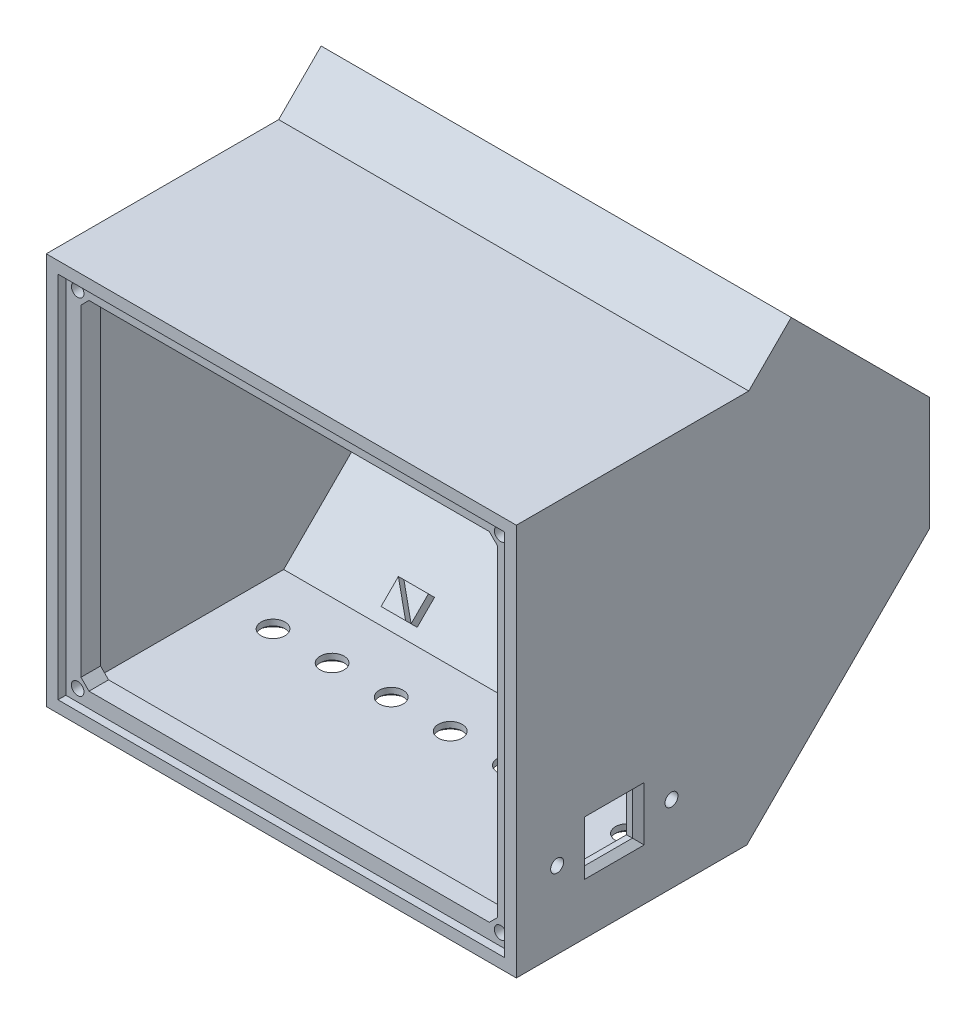
from build123d import *

# Parameters (mm, degrees)
BASEEXTRUDE_DEPTH        = 60
BASEEXTRUDE_DEPTH_BACK   = 60
SHELL2_T                 = -3
CONTROL_PANEL_W          = 110
CONTROL_PANEL_H          = 40
CUT_EXTRUDE1_DEPTH       = 10
CUT_EXTRUDE2_START       = 57
CUT_EXTRUDE2_OUTLINE_W   = 10.8
CUT_EXTRUDE2_OUTLINE_H   = 12.25
CUT_EXTRUDE2_OUTLINE_R   = 1.65
CUT_EXTRUDE2_DEPTH       = 3
REAR_PORTS_R             = 3.05
CUT_EXTRUDE3_DEPTH       = 3
REAR_PORTS_3_R           = 3.875
REAR_PORTS_3_R_2         = 3.05
CUT_EXTRUDE4_DEPTH       = 1.5
FILLET1_R                = 1.5
BOSS_EXTRUDE2_START      = 122.068760184
BOSS_EXTRUDE2_DEPTH      = 5
BOSS_EXTRUDE3_START      = 122.068760184
BOSS_EXTRUDE3_DEPTH      = 5
FILLET3_R                = 1.5
CUT_EXTRUDE6_START       = 122.068760184
CUT_EXTRUDE6_OUTLINE_R   = 1
CUT_EXTRUDE6_DEPTH       = 5
FILLET3_OF_MIRROR2_R     = 1.5
SKETCH17_W               = 90
SKETCH17_H               = 2
BOSS_EXTRUDE4_DEPTH      = 3.5
BOSS_EXTRUDE5_DEPTH      = 3.5
SKETCH19_W               = 90
SKETCH19_H               = 2
BOSS_EXTRUDE6_DEPTH      = 3.5
CONVERTOR_IN_PLACE_R     = 3.175
BOSS_EXTRUDE8_DEPTH      = 7.2
BOSS_EXTRUDE9_DEPTH      = 7.2
CONVERTOR_IN_PLACE_5_R   = 4.501396483
CONVERTOR_IN_PLACE_5_R_2 = 3.175
BOSS_EXTRUDE11_DEPTH     = 5.2
CUT_EXTRUDE7_START       = -2
CONVERTOR_IN_PLACE_7_R   = 1.7
CUT_EXTRUDE7_DEPTH       = 5.2
CHAMFER1_SIZE            = 1.5
BOSS_EXTRUDE12_START     = -2
BASE_W                   = 102.182919438
BASE_H                   = 6.863303695
BASE_W_2                 = 6.863303695
BASE_H_2                 = 82.284864873
BASE_R                   = 1.6
BOSS_EXTRUDE12_DEPTH     = 5


# Read off the part's stored shape, not the designer's step: Cut-Extrude2, Boss-Extrude2, Boss-Extrude3, Cut-Extrude6
with BuildPart() as part:
    # Silhouoette → BaseExtrude (new, two sides: drawn at the far end of the back side and taken through both)
    with BuildSketch(Plane(origin=(0, 0, 0), x_dir=(0, 0, -1), z_dir=(1, 0, 0)).offset(-BASEEXTRUDE_DEPTH_BACK)):
        Polygon((59.318338504, 100.101945435), (0, 100.101945435), (0, 0), (58.852776819, 0), (105.521824378, 46.669047558), (105.521824378, 75.59475319), (70.166485318, 110.950092249), align=None)
    extrude(amount=BASEEXTRUDE_DEPTH + BASEEXTRUDE_DEPTH_BACK)

    # Shell2
    shell2_openings = [part.faces().sort_by_distance(p)[0] for p in [
        (0, 50.050972717, 0),
    ]]
    offset(amount=SHELL2_T, openings=shell2_openings, kind=Kind.INTERSECTION)

    # Control Panel → Cut-Extrude1 (cut)
    with BuildSketch(Plane(origin=(0, 90.558288784, -90.558288784), x_dir=(-1, 0, 0), z_dir=(0, -0.7071067811865477, 0.7071067811865474))):
        with Locations((0, -3.838365022)):
            Rectangle(CONTROL_PANEL_W, CONTROL_PANEL_H)
    extrude(amount=CUT_EXTRUDE1_DEPTH, mode=Mode.SUBTRACT)

    # Cut-Extrude2 outline → Cut-Extrude2 (cut)
    with BuildSketch(Plane.YZ.offset(CUT_EXTRUDE2_START)):
        with Locations((20, -25)):
            Rectangle(CUT_EXTRUDE2_OUTLINE_W, CUT_EXTRUDE2_OUTLINE_H)
        with Locations((19.651957534, -39.6)):
            Circle(CUT_EXTRUDE2_OUTLINE_R)
        with Locations((19.651957534, -10.4)):
            Circle(CUT_EXTRUDE2_OUTLINE_R)
    extrude(amount=CUT_EXTRUDE2_DEPTH, mode=Mode.SUBTRACT)

    # Rear Ports → Cut-Extrude3 (cut)
    with BuildSketch(Plane(origin=(0, 0, 0), x_dir=(1, 0, 0), z_dir=(0, 1, 0))):
        with Locations(Location((45.232527778, 43.12294032, 0), (0, 0, 90))):
            Circle(REAR_PORTS_R)
        with Locations(Location((30.155018519, 43.12294032, 0), (0, 0, 90))):
            Circle(REAR_PORTS_R)
        with Locations(Location((15.077509259, 43.12294032, 0), (0, 0, 90))):
            Circle(REAR_PORTS_R)
        with Locations(Location((-15.077509259, 43.12294032, 0), (0, 0, 90))):
            Circle(REAR_PORTS_R)
        with Locations(Location((-30.155018519, 43.12294032, 0), (0, 0, 90))):
            Circle(REAR_PORTS_R)
        with Locations(Location((-45.232527778, 43.12294032, 0), (0, 0, 90))):
            Circle(REAR_PORTS_R)
        with Locations(Location((0, 43.12294032, 0), (0, 0, 90))):
            Circle(REAR_PORTS_R)
    extrude(amount=CUT_EXTRUDE3_DEPTH, mode=Mode.SUBTRACT)

    # Rear Ports<3> → Cut-Extrude4 (cut)
    # profile 1 of 7: a face of its own
    with BuildSketch(Plane(origin=(0, 0, 0), x_dir=(1, 0, 0), z_dir=(0, 1, 0))):
        with Locations(Location((45.232527778, 43.12294032, 0), (0, 0, 90))):
            Circle(REAR_PORTS_3_R)
        with Locations(Location((45.232527778, 43.12294032, 0), (0, 0, 90))):
            Circle(REAR_PORTS_3_R_2, mode=Mode.SUBTRACT)
    # profile 2 of 7: a face of its own
    with BuildSketch(Plane(origin=(0, 0, 0), x_dir=(1, 0, 0), z_dir=(0, 1, 0))):
        with Locations(Location((30.155018519, 43.12294032, 0), (0, 0, 90))):
            Circle(REAR_PORTS_3_R)
        with Locations(Location((30.155018519, 43.12294032, 0), (0, 0, 90))):
            Circle(REAR_PORTS_3_R_2, mode=Mode.SUBTRACT)
    # profile 3 of 7: a face of its own
    with BuildSketch(Plane(origin=(0, 0, 0), x_dir=(1, 0, 0), z_dir=(0, 1, 0))):
        with Locations(Location((15.077509259, 43.12294032, 0), (0, 0, 90))):
            Circle(REAR_PORTS_3_R)
        with Locations(Location((15.077509259, 43.12294032, 0), (0, 0, 90))):
            Circle(REAR_PORTS_3_R_2, mode=Mode.SUBTRACT)
    # profile 4 of 7: a face of its own
    with BuildSketch(Plane(origin=(0, 0, 0), x_dir=(1, 0, 0), z_dir=(0, 1, 0))):
        with Locations(Location((-15.077509259, 43.12294032, 0), (0, 0, 90))):
            Circle(REAR_PORTS_3_R)
        with Locations(Location((-15.077509259, 43.12294032, 0), (0, 0, 90))):
            Circle(REAR_PORTS_3_R_2, mode=Mode.SUBTRACT)
    # profile 5 of 7: a face of its own
    with BuildSketch(Plane(origin=(0, 0, 0), x_dir=(1, 0, 0), z_dir=(0, 1, 0))):
        with Locations(Location((-30.155018519, 43.12294032, 0), (0, 0, 90))):
            Circle(REAR_PORTS_3_R)
        with Locations(Location((-30.155018519, 43.12294032, 0), (0, 0, 90))):
            Circle(REAR_PORTS_3_R_2, mode=Mode.SUBTRACT)
    # profile 6 of 7: a face of its own
    with BuildSketch(Plane(origin=(0, 0, 0), x_dir=(1, 0, 0), z_dir=(0, 1, 0))):
        with Locations(Location((-45.232527778, 43.12294032, 0), (0, 0, 90))):
            Circle(REAR_PORTS_3_R)
        with Locations(Location((-45.232527778, 43.12294032, 0), (0, 0, 90))):
            Circle(REAR_PORTS_3_R_2, mode=Mode.SUBTRACT)
    # profile 7 of 7: a face of its own
    with BuildSketch(Plane(origin=(0, 0, 0), x_dir=(1, 0, 0), z_dir=(0, 1, 0))):
        with Locations(Location((0, 43.12294032, 0), (0, 0, 90))):
            Circle(REAR_PORTS_3_R)
    extrude(amount=CUT_EXTRUDE4_DEPTH, mode=Mode.SUBTRACT)

    # Fillet1
    fillet1_edges = [part.edges().sort_by_distance(p)[0] for p in [
        (45.232527778, 0, -39.24794032),
        (0, 0, -39.24794032),
        (-45.232527778, 0, -39.24794032),
        (-30.155018519, 0, -39.24794032),
        (-15.077509259, 0, -39.24794032),
        (15.077509259, 0, -39.24794032),
        (30.155018519, 0, -39.24794032),
    ]]
    fillet(fillet1_edges, radius=FILLET1_R - 0.0001)  # a hair under: the kernel refuses the full size

    # Boss-Extrude2 outline → Boss-Extrude2 (add)
    with BuildSketch(Plane(origin=(0, 0, 0), x_dir=(1, 0, 0), z_dir=(0, 0.707106781186548, -0.707106781186547)).offset(BOSS_EXTRUDE2_START)):
        with BuildLine():
            ThreePointArc((-50, 6.161634978), (-46.464466094, 7.626101072), (-45, 11.161634978))
            Line((-45, 11.161634978), (-45, 21.161634978))
            Line((-45, 21.161634978), (-57, 21.161634978))
            Line((-57, 21.161634978), (-57, 6.161634978))
            Line((-57, 6.161634978), (-50, 6.161634978))
        make_face()
    boss_extrude2 = extrude(amount=BOSS_EXTRUDE2_DEPTH)

    # Boss-Extrude3 outline → Boss-Extrude3 (add)
    with BuildSketch(Plane(origin=(0, 0, 0), x_dir=(1, 0, 0), z_dir=(0, 0.707106781186548, -0.707106781186547)).offset(BOSS_EXTRUDE3_START)):
        with BuildLine():
            ThreePointArc((-45, -18.838365022), (-46.464466094, -15.302831116), (-50, -13.838365022))
            Line((-50, -13.838365022), (-57, -13.838365022))
            Line((-57, -13.838365022), (-57, -25.838365022))
            Line((-57, -25.838365022), (-45, -25.838365022))
            Line((-45, -25.838365022), (-45, -18.838365022))
        make_face()
    boss_extrude3 = extrude(amount=BOSS_EXTRUDE3_DEPTH)

    # Fillet3
    fillet3_edges = [part.edges().sort_by_distance(p)[0] for p in [
        (-46.464466094, 80.923180315, -91.708115879),
        (-53.5, 81.958714221, -90.672581973),
        (-45, 74.887646409, -97.743649785),
        (-53.5, 96.100849845, -76.53044635),
        (-45, 102.111257485, -70.520038709),
        (-46.464466094, 97.136383751, -75.494912444),
    ]]
    fillet(fillet3_edges, radius=FILLET3_R)

    # Cut-Extrude6 outline → Cut-Extrude6 (cut)
    with BuildSketch(Plane(origin=(0, 0, 0), x_dir=(1, 0, 0), z_dir=(0, 0.707106781186548, -0.707106781186547)).offset(CUT_EXTRUDE6_START)):
        with Locations((-50, -18.838365022)):
            Circle(CUT_EXTRUDE6_OUTLINE_R)
        with Locations((-50, 11.161634978)):
            Circle(CUT_EXTRUDE6_OUTLINE_R)
    cut_extrude6 = extrude(amount=CUT_EXTRUDE6_DEPTH, mode=Mode.SUBTRACT)

    # Mirror2: Boss-Extrude2, Boss-Extrude3, Cut-Extrude6 across plane
    add(boss_extrude2.mirror(Plane(origin=(0, 0, 0), x_dir=(0, 0, 1), z_dir=(1, 0, 0))))
    add(boss_extrude3.mirror(Plane(origin=(0, 0, 0), x_dir=(0, 0, 1), z_dir=(1, 0, 0))))
    add(cut_extrude6.mirror(Plane(origin=(0, 0, 0), x_dir=(0, 0, 1), z_dir=(1, 0, 0))), mode=Mode.SUBTRACT)

    # Fillet3 of Mirror2
    fillet3_of_mirror2_edges = [part.edges().sort_by_distance(p)[0] for p in [
        (46.464466094, 80.923180315, -91.708115879),
        (53.5, 81.958714221, -90.672581973),
        (45, 74.887646409, -97.743649785),
        (53.5, 96.100849845, -76.53044635),
        (45, 102.111257485, -70.520038709),
        (46.464466094, 97.136383751, -75.494912444),
    ]]
    fillet(fillet3_of_mirror2_edges, radius=FILLET3_OF_MIRROR2_R)

    # Sketch17 → Boss-Extrude4 (add)
    with BuildSketch(Plane(origin=(0, -11.428001688, -11.428001688), x_dir=(1, 0, 0), z_dir=(0, 0.7071067811865474, 0.7071067811865477))):
        with Locations((0, 126.068760184)):
            Rectangle(SKETCH17_W, SKETCH17_H)
    extrude(amount=BOSS_EXTRUDE4_DEPTH)

    # Sketch18 → Boss-Extrude5 (add)
    with BuildSketch(Plane(origin=(-55, 0, 0), x_dir=(0, 0, -1), z_dir=(1, 0, 0))):
        Polygon((94.208115879, 85.494248127), (80.065980255, 99.63638375), (78.651766693, 98.222170188), (92.793902316, 84.080034564), align=None)
    boss_extrude5 = extrude(amount=BOSS_EXTRUDE5_DEPTH)

    # Sketch19 → Boss-Extrude6 (add)
    with BuildSketch(Plane(origin=(0, 16.85626956, 16.85626956), x_dir=(1, 0, 0), z_dir=(0, -0.7071067811865474, -0.7071067811865477))):
        with Locations((0, -126.068760184)):
            Rectangle(SKETCH19_W, SKETCH19_H)
    extrude(amount=BOSS_EXTRUDE6_DEPTH)

    # Mirror3: Boss-Extrude5 across plane
    add(boss_extrude5.mirror(Plane(origin=(0, 0, 0), x_dir=(0, 0, 1), z_dir=(1, 0, 0))))

    # Convertor in place → Boss-Extrude8 (add)
    with BuildSketch(Plane(origin=(0, -29.42638841, -29.42638841), x_dir=(-1, 0, 0), z_dir=(-3.4914813388431334e-15, -0.7071067811865462, -0.7071067811865488))):
        with Locations(Location((-26.6, 74.615197581, 0), (0, 0, 90))):
            Circle(CONVERTOR_IN_PLACE_R)
        with Locations(Location((26.6, 74.615197581, 0), (0, 0, 90))):
            Circle(CONVERTOR_IN_PLACE_R)
    extrude(amount=-BOSS_EXTRUDE8_DEPTH)

    # Convertor in place<4> → Boss-Extrude9 (add)
    with BuildSketch(Plane(origin=(0, -29.42638841, -29.42638841), x_dir=(-1, 0, 0), z_dir=(-3.4914813388431334e-15, -0.7071067811865462, -0.7071067811865488))):
        Polygon((31.3, 52.115197581), (25.05, 45.865197581), (31.3, 45.865197581), align=None)
        Polygon((-25.95, 45.865197581), (-32.2, 52.115197581), (-32.2, 45.865197581), align=None)
        Polygon((-25.95, 103.365197581), (-32.2, 103.365197581), (-32.2, 97.115197581), align=None)
        Polygon((31.3, 103.365197581), (25.05, 103.365197581), (31.3, 97.115197581), align=None)
    extrude(amount=-BOSS_EXTRUDE9_DEPTH)

    # Convertor in place<5> → Boss-Extrude11 (add)
    # profile 1 of 6: a face of its own
    with BuildSketch(Plane(origin=(0, -29.42638841, -29.42638841), x_dir=(-1, 0, 0), z_dir=(-3.4914813388431334e-15, -0.7071067811865462, -0.7071067811865488))):
        Polygon((31.3, 52.115197581), (25.05, 45.865197581), (25.05, 52.115197581), align=None)
    # profile 2 of 6: a face of its own
    with BuildSketch(Plane(origin=(0, -29.42638841, -29.42638841), x_dir=(-1, 0, 0), z_dir=(-3.4914813388431334e-15, -0.7071067811865462, -0.7071067811865488))):
        Polygon((-25.95, 45.865197581), (-25.95, 52.115197581), (-32.2, 52.115197581), align=None)
    # profile 3 of 6: a face of its own
    with BuildSketch(Plane(origin=(0, -29.42638841, -29.42638841), x_dir=(-1, 0, 0), z_dir=(-3.4914813388431334e-15, -0.7071067811865462, -0.7071067811865488))):
        Polygon((-32.2, 97.115197581), (-25.95, 97.115197581), (-25.95, 103.365197581), align=None)
    # profile 4 of 6: a face of its own
    with BuildSketch(Plane(origin=(0, -29.42638841, -29.42638841), x_dir=(-1, 0, 0), z_dir=(-3.4914813388431334e-15, -0.7071067811865462, -0.7071067811865488))):
        with Locations(Location((26.6, 74.615197581, 0), (0, 0, 90))):
            Circle(CONVERTOR_IN_PLACE_5_R)
        with Locations(Location((26.6, 74.615197581, 0), (0, 0, 90))):
            Circle(CONVERTOR_IN_PLACE_5_R_2, mode=Mode.SUBTRACT)
    # profile 5 of 6: a face of its own
    with BuildSketch(Plane(origin=(0, -29.42638841, -29.42638841), x_dir=(-1, 0, 0), z_dir=(-3.4914813388431334e-15, -0.7071067811865462, -0.7071067811865488))):
        with Locations(Location((-26.6, 74.615197581, 0), (0, 0, 90))):
            Circle(CONVERTOR_IN_PLACE_5_R)
        with Locations(Location((-26.6, 74.615197581, 0), (0, 0, 90))):
            Circle(CONVERTOR_IN_PLACE_5_R_2, mode=Mode.SUBTRACT)
    # profile 6 of 6: a face of its own
    with BuildSketch(Plane(origin=(0, -29.42638841, -29.42638841), x_dir=(-1, 0, 0), z_dir=(-3.4914813388431334e-15, -0.7071067811865462, -0.7071067811865488))):
        Polygon((31.3, 97.115197581), (25.05, 97.115197581), (25.05, 103.365197581), align=None)
    extrude(amount=-BOSS_EXTRUDE11_DEPTH)

    # Convertor in place<7> → Cut-Extrude7 (cut)
    with BuildSketch(Plane(origin=(0, -29.42638841, -29.42638841), x_dir=(-1, 0, 0), z_dir=(-3.4914813388431334e-15, -0.7071067811865462, -0.7071067811865488)).offset(CUT_EXTRUDE7_START)):
        with Locations(Location((26.6, 74.615197581, 0), (0, 0, 90))):
            Circle(CONVERTOR_IN_PLACE_7_R)
        with Locations(Location((-26.6, 74.615197581, 0), (0, 0, 90))):
            Circle(CONVERTOR_IN_PLACE_7_R)
    extrude(amount=-CUT_EXTRUDE7_DEPTH, mode=Mode.SUBTRACT)

    # Chamfer1
    chamfer1_edges = [part.edges().sort_by_distance(p)[0] for p in [
        (60, 14.6, -25),
        (60, 20, -31.125),
        (60, 25.4, -25),
        (60, 20, -18.875),
    ]]
    chamfer(chamfer1_edges, length=CHAMFER1_SIZE)

    # Base → Boss-Extrude12 (add)
    # profile 1 of 8: a face of its own
    with BuildSketch(Plane.XY.offset(BOSS_EXTRUDE12_START)):
        with Locations((0, 3.431651848)):
            Rectangle(BASE_W, BASE_H)
    # profile 2 of 8: a face of its own
    with BuildSketch(Plane.XY.offset(BOSS_EXTRUDE12_START)):
        with Locations((56.568348153, 50.050972718)):
            Rectangle(BASE_W_2, BASE_H_2)
    # profile 3 of 8: a face of its own
    with BuildSketch(Plane.XY.offset(BOSS_EXTRUDE12_START)):
        with Locations((-56.568348153, 50.050972718)):
            Rectangle(BASE_W_2, BASE_H_2)
    # profile 4 of 8: a face of its own
    with BuildSketch(Plane.XY.offset(BOSS_EXTRUDE12_START)):
        with Locations((0, 96.670293587)):
            Rectangle(BASE_W, BASE_H)
    # profile 5 of 8: a face of its own
    with BuildSketch(Plane.XY.offset(BOSS_EXTRUDE12_START)):
        Polygon((60, 100.101945435), (60, 91.193405154), (53.136696305, 91.193405154), (51.091459719, 93.23864174), (51.091459719, 100.101945435), align=None)
        with Locations((53.982183069, 94.084128503)):
            Circle(BASE_R, mode=Mode.SUBTRACT)
    # profile 6 of 8: a face of its own
    with BuildSketch(Plane.XY.offset(BOSS_EXTRUDE12_START)):
        Polygon((-60, 100.101945435), (-51.091459719, 100.101945435), (-51.091459719, 93.23864174), (-53.136696305, 91.193405154), (-60, 91.193405154), align=None)
        with Locations((-53.982183069, 94.084128503)):
            Circle(BASE_R, mode=Mode.SUBTRACT)
    # profile 7 of 8: a face of its own
    with BuildSketch(Plane.XY.offset(BOSS_EXTRUDE12_START)):
        Polygon((-51.091459719, 6.863303695), (-53.136696305, 8.908540281), (-60, 8.908540281), (-60, 0), (-51.091459719, 0), align=None)
        with Locations((-53.982183069, 6.017816931)):
            Circle(BASE_R, mode=Mode.SUBTRACT)
    # profile 8 of 8: a face of its own
    with BuildSketch(Plane.XY.offset(BOSS_EXTRUDE12_START)):
        Polygon((60, 8.908540281), (53.136696305, 8.908540281), (51.091459719, 6.863303695), (51.091459719, 0), (60, 0), align=None)
        with Locations((53.982183069, 6.017816931)):
            Circle(BASE_R, mode=Mode.SUBTRACT)
    extrude(amount=-BOSS_EXTRUDE12_DEPTH)


solid = part.part
